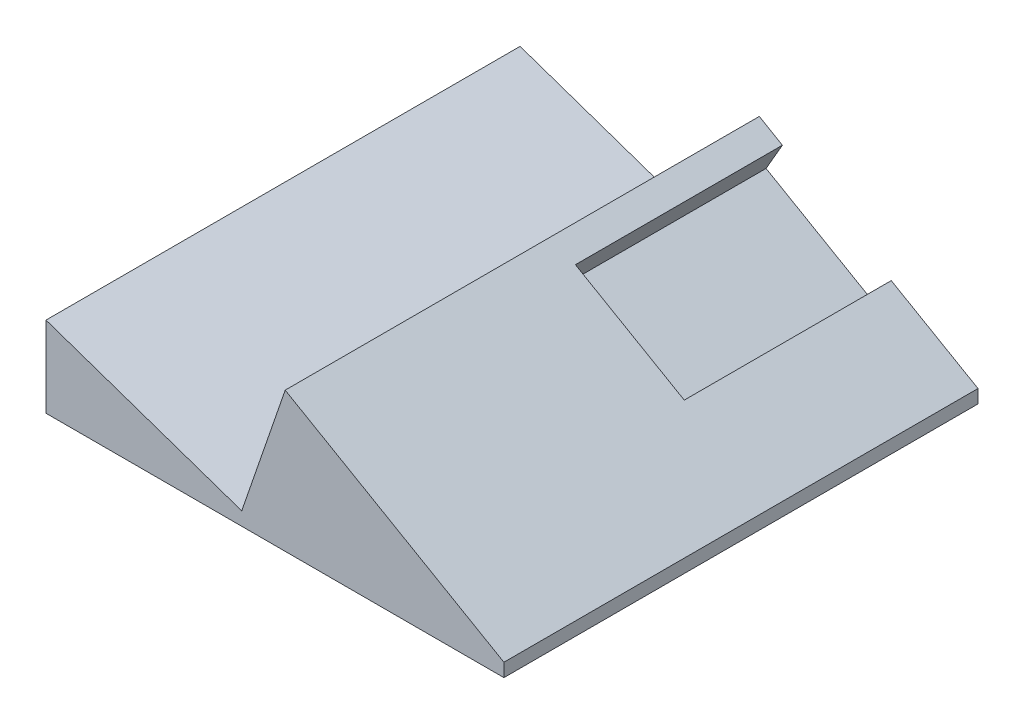
from build123d import *

# Parameters (mm, degrees)
SKETCH1_W           = 30
SKETCH1_H           = 103
BOSS_EXTRUDE1_DEPTH = 2
BOSS_EXTRUDE2_DEPTH = 103
SKETCH6_W           = 18.822447129
SKETCH6_H           = 70
CUT_EXTRUDE3_DEPTH  = 4.8963936
SKETCH7_W           = 32
SKETCH7_H           = 20.911223564
CUT_EXTRUDE4_DEPTH  = 73


with BuildPart() as part:
    # Sketch1 → Boss-Extrude1 (new body)
    with BuildSketch(Plane(origin=(0, 0, 0), x_dir=(1, 0, 0), z_dir=(0, 1, 0))):
        Rectangle(SKETCH1_W, SKETCH1_H)
    extrude(amount=BOSS_EXTRUDE1_DEPTH)

    # Sketch2 → Boss-Extrude2 (add)
    with BuildSketch(Plane.XY.offset(51.5)):
        Polygon((0, 2), (15, 2), (-17.755200047, 20.911223564), (-24.26408807, 2), (-53.576484595, 12.088776436), (-53.576484595, 0), (-15, 0), (-15, 2), align=None)
    extrude(amount=-BOSS_EXTRUDE2_DEPTH)

    # Sketch6 → Cut-Extrude3 (cut)
    with BuildSketch(Plane(origin=(4.616025404, 7.995190528, 0), x_dir=(0.8660254037844382, -0.5000000000000009, 0), z_dir=(0.5000000000000009, 0.8660254037844382, 0))):
        with Locations((-12.420842507, 23.5)):
            Rectangle(SKETCH6_W, SKETCH6_H)
    extrude(amount=-CUT_EXTRUDE3_DEPTH, mode=Mode.SUBTRACT)

    # Sketch7 → Cut-Extrude4 (cut)
    with BuildSketch(Plane.ZY.offset(53.576484595)):
        with Locations((-35.5, 10.455611782)):
            Rectangle(SKETCH7_W, SKETCH7_H)
    extrude(amount=-CUT_EXTRUDE4_DEPTH, mode=Mode.SUBTRACT)


solid = part.part
